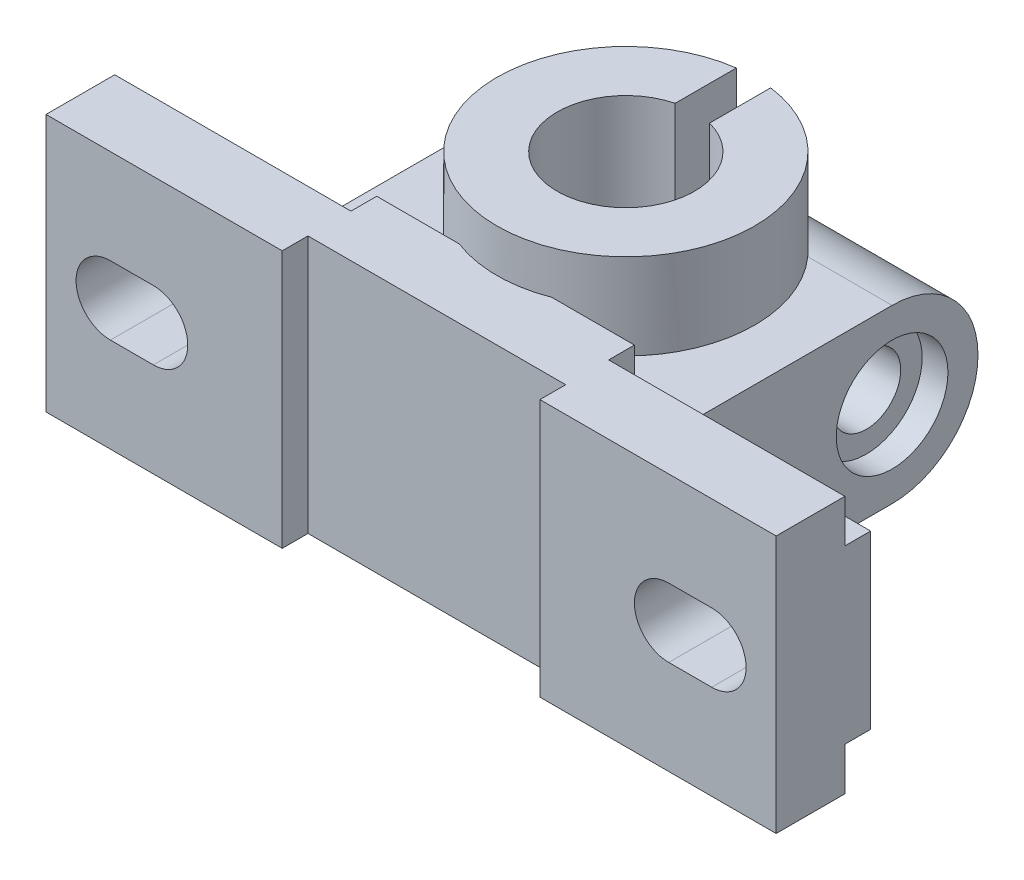
from build123d import *

# Parameters (mm, degrees)
SKETCH_1_W                = 85
SKETCH_1_H                = 30
EXTRUDE_1_DEPTH           = 11
SKETCH_2_W                = 27.5
SKETCH_2_H                = 5
CUT_EXTRUDE_3_DEPTH       = 3
CUT_EXTRUDE_5_DEPTH       = 33
EXTRUDE_6_DEPTH           = 20
CUT_EXTRUDE_6_DEPTH       = 20
SKETCH_10_R               = 4
EXTRUDE_7_DEPTH           = 21
SKETCH_11_R               = 6.5
CUT_EXTRUDE_9_DEPTH       = 40.5
SKETCH_13_R               = 6.5
EXTRUDE_8_DEPTH           = 18
SKETCH_14_R               = 4
CUT_EXTRUDE_10_DEPTH      = 18
SKETCH_15_R               = 8
CUT_EXTRUDE_11_DEPTH      = 18
CUT_EXTRUDE_12_DEPTH      = 18
CUT_EXTRUDE_13_DEPTH      = 58.984912
CUT_EXTRUDE_13_DEPTH_BACK = 58.984912
SKETCH_19_W               = 30
SKETCH_19_H               = 3


with BuildPart() as part:
    # 草图1 → 凸台-拉伸1 (new body)
    with BuildSketch(Plane.XY):
        Rectangle(SKETCH_1_W, SKETCH_1_H)
    extrude(amount=EXTRUDE_1_DEPTH)

    # 草图2 → 切除-拉伸3 (cut)
    with BuildSketch(Plane.XY):
        with Locations((-28.75, 12.5)):
            Rectangle(SKETCH_2_W, SKETCH_2_H)
        with Locations((28.75, 12.5)):
            Rectangle(SKETCH_2_W, SKETCH_2_H)
        with Locations((28.75, -12.5)):
            Rectangle(SKETCH_2_W, SKETCH_2_H)
        with Locations((-28.75, -12.5)):
            Rectangle(SKETCH_2_W, SKETCH_2_H)
    extrude(amount=CUT_EXTRUDE_3_DEPTH, mode=Mode.SUBTRACT)

    # 草图6 → 切除-拉伸5 (cut)
    with BuildSketch(Plane.XY):
        with BuildLine():
            Line((-30, 4), (-35, 4))
            ThreePointArc((-35, 4), (-37.828427, 2.828427), (-39, 0))
            ThreePointArc((-39, 0), (-37.828427, -2.828427), (-35, -4))
            Line((-35, -4), (-30, -4))
            ThreePointArc((-30, -4), (-26, 0), (-30, 4))
        make_face()
        with BuildLine():
            ThreePointArc((39, 0), (37.828427, 2.828427), (35, 4))
            Line((35, 4), (30, 4))
            ThreePointArc((30, 4), (26, 0), (30, -4))
            Line((30, -4), (35, -4))
            ThreePointArc((35, -4), (37.828427, -2.828427), (39, 0))
        make_face()
    extrude(amount=CUT_EXTRUDE_5_DEPTH, mode=Mode.SUBTRACT)

    # 草图8 → 凸台-拉伸6 (add, symmetric)
    with BuildSketch(Plane(origin=(0, 0, 0), x_dir=(1, 0, 0), z_dir=(0, 1, 0))):
        with BuildLine():
            ThreePointArc((-5.385165, 0), (-2.738613, -0.747881), (0, -1))
            ThreePointArc((0, -1), (2.738613, -0.747881), (5.385165, 0))
            ThreePointArc((5.385165, 0), (12.364818, 5.508165), (15, 14))
            ThreePointArc((15, 14), (0, 29), (-15, 14))
            ThreePointArc((-15, 14), (-12.364818, 5.508165), (-5.385165, 0))
        make_face()
        with BuildLine():
            ThreePointArc((8, 14), (5.656854, 8.343146), (0, 6))
            ThreePointArc((0, 6), (-5.656854, 19.656854), (8, 14))
        make_face(mode=Mode.SUBTRACT)
    extrude(amount=EXTRUDE_6_DEPTH, both=True)

    # 草图9 → 切除-拉伸6 (cut, symmetric)
    with BuildSketch(Plane(origin=(0, 0, 0), x_dir=(1, 0, 0), z_dir=(0, 1, 0))):
        Polygon((2, 42.203899), (-2, 42.203899), (-2, 20.468656), (0, 20.468656), (2, 20.468656), align=None)
    extrude(amount=CUT_EXTRUDE_6_DEPTH, both=True, mode=Mode.SUBTRACT)

    # 草图10 → 凸台-拉伸7 (add, symmetric)
    with BuildSketch(Plane(origin=(0, 0, 0), x_dir=(0, 0, -1), z_dir=(1, 0, 0))):
        with BuildLine():
            Line((0, 10), (0, -10))
            Line((0, -10), (24, -10))
            ThreePointArc((24, -10), (34, 0), (24, 10))
            Line((24, 10), (0, 10))
        make_face()
        with Locations((24, 0)):
            Circle(SKETCH_10_R, mode=Mode.SUBTRACT)
    extrude(amount=EXTRUDE_7_DEPTH, both=True)

    # 草图11 → 切除-拉伸9 (cut, symmetric)
    with BuildSketch(Plane(origin=(0, 0, 0), x_dir=(0, 0, -1), z_dir=(1, 0, 0))):
        with Locations((24, 0)):
            Circle(SKETCH_11_R)
    extrude(amount=CUT_EXTRUDE_9_DEPTH, both=True, mode=Mode.SUBTRACT)

    # 草图13 → 凸台-拉伸8 (add, symmetric)
    with BuildSketch(Plane(origin=(0, 0, 0), x_dir=(0, 0, -1), z_dir=(1, 0, 0))):
        with Locations((24, 0)):
            Circle(SKETCH_13_R)
    extrude(amount=EXTRUDE_8_DEPTH, both=True)

    # 草图14 → 切除-拉伸10 (cut, symmetric)
    with BuildSketch(Plane(origin=(0, 0, 0), x_dir=(0, 0, -1), z_dir=(1, 0, 0))):
        with Locations((24, 0)):
            Circle(SKETCH_14_R)
    extrude(amount=CUT_EXTRUDE_10_DEPTH, both=True, mode=Mode.SUBTRACT)

    # 草图15 → 切除-拉伸11 (cut, symmetric)
    with BuildSketch(Plane(origin=(0, 0, 0), x_dir=(1, 0, 0), z_dir=(0, 1, 0))):
        with Locations((0, 14)):
            Circle(SKETCH_15_R)
    extrude(amount=CUT_EXTRUDE_11_DEPTH, both=True, mode=Mode.SUBTRACT)

    # 草图16 → 切除-拉伸12 (cut, symmetric)
    with BuildSketch(Plane(origin=(0, 0, 0), x_dir=(1, 0, 0), z_dir=(0, 1, 0))):
        with BuildLine():
            Line((-2, 34), (2, 34))
            Line((2, 34), (2, 21.745967))
            ThreePointArc((2, 21.745967), (0, 22), (-2, 21.745967))
            Line((-2, 21.745967), (-2, 34))
        make_face()
    extrude(amount=CUT_EXTRUDE_12_DEPTH, both=True, mode=Mode.SUBTRACT)

    # 草图19 → 切除-拉伸13 (cut, two sides: drawn at the far end of the back side and taken through both)
    with BuildSketch(Plane(origin=(0, 0, 0), x_dir=(1, 0, 0), z_dir=(0, 1, 0)).offset(-CUT_EXTRUDE_13_DEPTH_BACK)):
        with Locations((0, -9.5)):
            Rectangle(SKETCH_19_W, SKETCH_19_H)
    extrude(amount=CUT_EXTRUDE_13_DEPTH + CUT_EXTRUDE_13_DEPTH_BACK, mode=Mode.SUBTRACT)


solid = part.part
